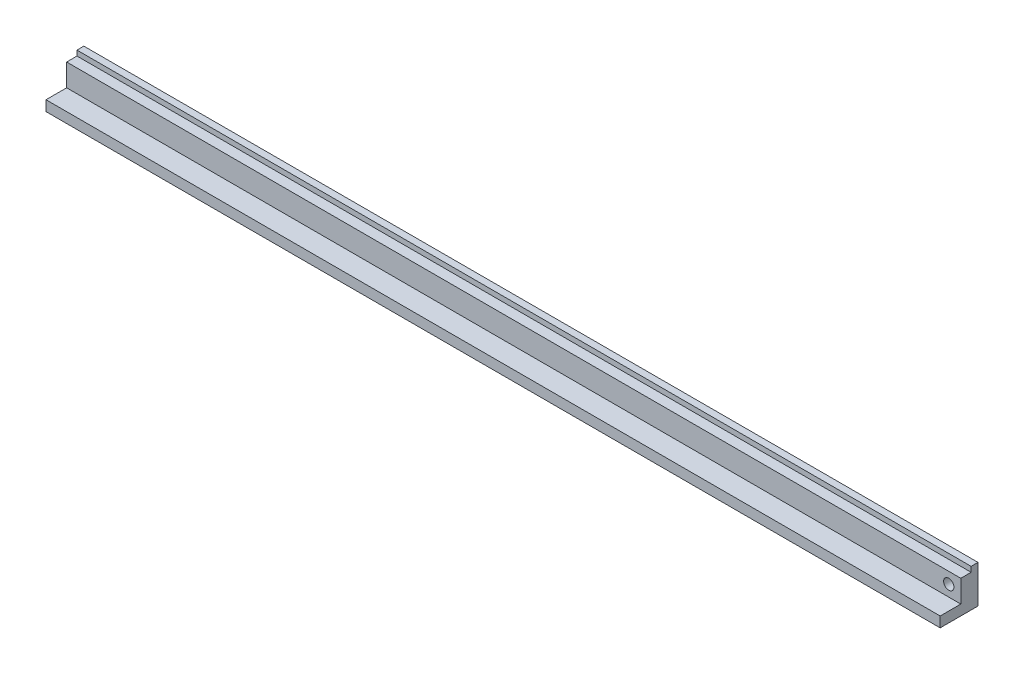
from build123d import *

# Parameters (mm, degrees)
EXTRUDE_1_DEPTH     = 260
SKETCH_2_R          = 1.5
CUT_EXTRUDE_1_DEPTH = 261.301747977


with BuildPart() as part:
    # Эскиз1 → Бобышка-Вытянуть1 (new body)
    with BuildSketch(Plane(origin=(0, 0, 0), x_dir=(0, 0, -1), z_dir=(1, 0, 0))):
        Polygon((0, 0), (-11, 0), (-11, 3), (-5, 3), (-5, 9.5), (-2, 9.5), (-2, 11), (0, 11), align=None)
    extrude(amount=EXTRUDE_1_DEPTH)

    # Эскиз2 → Вырез-Вытянуть1 (cut, through all)
    with BuildSketch(Plane.XY.offset(5)):
        with Locations((256.5, 6.25)):
            Circle(SKETCH_2_R)
    extrude(amount=-CUT_EXTRUDE_1_DEPTH, mode=Mode.SUBTRACT)


solid = part.part
